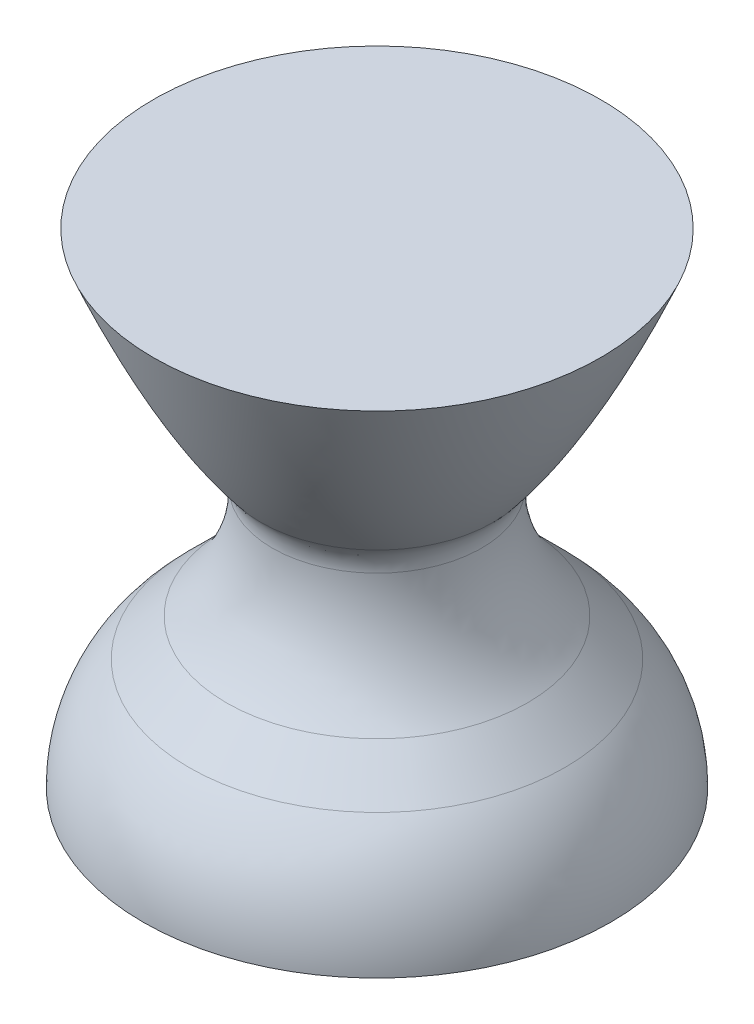
from build123d import *


with BuildPart() as part:
    # Sketch1 → Revolve2 (revolve)
    with BuildSketch(Plane(origin=(0, 0, 0), x_dir=(0, 0, -1), z_dir=(1, 0, 0))):
        with BuildLine():
            Line((51.50993, 51.720196701), (0, 51.720196701))
            Line((0, 51.720196701), (0, -59.725347838))
            Line((0, -59.725347838), (53.887141394, -59.725347838))
            add(Edge.make_bspline(
                [(53.887141394, -59.725347838), (53.887124672, -59.65481778), (53.886564434, -59.513240846), (53.884115261, -59.17939989), (53.877729875, -58.902632162), (53.868162634, -58.530406249), (53.855449514, -58.210679168), (53.835603971, -57.779440337), (53.805481675, -57.278812397), (53.761139278, -56.685860388), (53.682050224, -55.846359939), (53.582004075, -55.006067387), (53.461069448, -54.170363498), (53.290984853, -53.170390639), (53.096019691, -52.175451018), (52.870113433, -51.186596873), (52.613537072, -50.205603156), (52.332598181, -49.231253539), (52.027445178, -48.26421202), (51.636388985, -47.147463726), (51.142095069, -45.888845597), (50.601036251, -44.6495248), (50.014095868, -43.431386405), (49.38189259, -42.235916942), (48.705640428, -41.065127082), (47.985739215, -39.920102947), (47.224120544, -38.803373779), (46.520678255, -37.850903801), (45.894172368, -37.055261721), (45.353308859, -36.403089657), (44.915506314, -35.894052151), (44.515057333, -35.446885117), (44.181659068, -35.084596861), (43.874054972, -34.76037338), (43.674156901, -34.551626579), (43.444425391, -34.318643867), (43.343794211, -34.217311734), (43.293911105, -34.167450295)],
                knots=[0.082637729, 0.082637729, 0.082637729, 0.082637729, 0.082637729, 0.092574926, 0.102512123, 0.11244932, 0.122386517, 0.132323714, 0.142260911, 0.162135305, 0.182009699, 0.201884093, 0.24163288, 0.261507274, 0.281381668, 0.321130456, 0.360879243, 0.380753637, 0.400628031, 0.440376819, 0.480125606, 0.519874394, 0.559623181, 0.599371969, 0.639120757, 0.678869544, 0.718618332, 0.75836712, 0.798115907, 0.817990301, 0.837864695, 0.857739089, 0.877613483, 0.88755068, 0.897487877, 0.907425074, 0.91736227, 0.91736227, 0.91736227, 0.91736227, 0.91736227], degree=4))
            Line((43.293911105, -34.167450295), (34.686282905, -25.559822095))
            add(Edge.make_bspline(
                [(24.099067874, 0), (24.099069105, -0.070528643), (24.099598253, -0.213584186), (24.101973939, -0.543182912), (24.108298334, -0.824160393), (24.117783457, -1.194822068), (24.130425751, -1.513435054), (24.146225976, -1.861939599), (24.165181235, -2.193706868), (24.192818851, -2.618069396), (24.232287059, -3.122033942), (24.303299722, -3.87997867), (24.423126697, -4.886450384), (24.599486068, -6.056710755), (24.850885262, -7.385166409), (25.151795348, -8.703574509), (25.501770663, -10.009637202), (25.900361028, -11.30181959), (26.346945442, -12.578099327), (26.841003378, -13.836887475), (27.381673182, -15.076197119), (27.968479451, -16.294609783), (28.600139467, -17.489938782), (29.27653247, -18.661287744), (29.995445181, -19.805743382), (30.758022083, -20.923860059), (31.45916728, -21.874411744), (32.088736213, -22.673445463), (32.624128509, -23.32042212), (33.072255863, -23.840004997), (33.508450123, -24.329816226), (33.93582622, -24.788484369), (34.24555874, -25.113868289), (34.536860059, -25.409649025), (34.636412527, -25.50994991), (34.686282905, -25.559822095)],
                knots=[0.082637729, 0.082637729, 0.082637729, 0.082637729, 0.082637729, 0.092574926, 0.102512123, 0.11244932, 0.122386517, 0.132323714, 0.142260911, 0.152198108, 0.162135305, 0.182009699, 0.201884093, 0.24163288, 0.281381668, 0.321130456, 0.360879243, 0.400628031, 0.440376819, 0.480125606, 0.519874394, 0.559623181, 0.599371969, 0.639120757, 0.678869544, 0.718618332, 0.75836712, 0.798115907, 0.817990301, 0.837864695, 0.857739089, 0.877613483, 0.897487877, 0.907425074, 0.91736227, 0.91736227, 0.91736227, 0.91736227, 0.91736227], degree=4))
            add(Edge.make_bspline(
                [(24.099067874, 0), (24.0990685, 0.035892652), (24.099606331, 0.11011369), (24.102023723, 0.267641069), (24.108461568, 0.427064117), (24.120533599, 0.646764266), (24.141435087, 0.901433328), (24.175184719, 1.202537273), (24.226499305, 1.542050498), (24.290543701, 1.880996777), (24.367141601, 2.21635442), (24.456323571, 2.549239421), (24.557741413, 2.878092645), (24.671619071, 3.203347041), (24.797196771, 3.523627157), (24.935285977, 3.839666733), (25.084070301, 4.149282184), (25.246012222, 4.454783123), (25.416488505, 4.751301576), (25.602514721, 5.045703861), (25.79178827, 5.325518936), (26.004405474, 5.610727543), (26.178876374, 5.832913647), (26.366345756, 6.049951637), (26.504555248, 6.208641646), (26.67044207, 6.382121779), (26.744520261, 6.458478841), (26.795279203, 6.50923965)],
                knots=[0.082568816, 0.082568816, 0.082568816, 0.082568816, 0.082568816, 0.102426634, 0.122284453, 0.142142271, 0.162000089, 0.201715725, 0.241431362, 0.281146998, 0.320862634, 0.360578271, 0.400293907, 0.440009544, 0.47972518, 0.519440816, 0.559156453, 0.598872089, 0.638587725, 0.678303362, 0.718018998, 0.757734635, 0.797450271, 0.837165907, 0.857023726, 0.876881544, 0.91659718, 0.91659718, 0.91659718, 0.91659718, 0.91659718], degree=4))
            add(Edge.make_bspline(
                [(26.795279203, 6.50923965), (39.15258557, 21.980023797), (51.50993, 51.720196701)],
                knots=[0, 0, 0, 1, 1, 1], degree=2))
        make_face()
    revolve(axis=Axis((0, 66.749191091, 0), (0, -1, 0)))


solid = part.part
